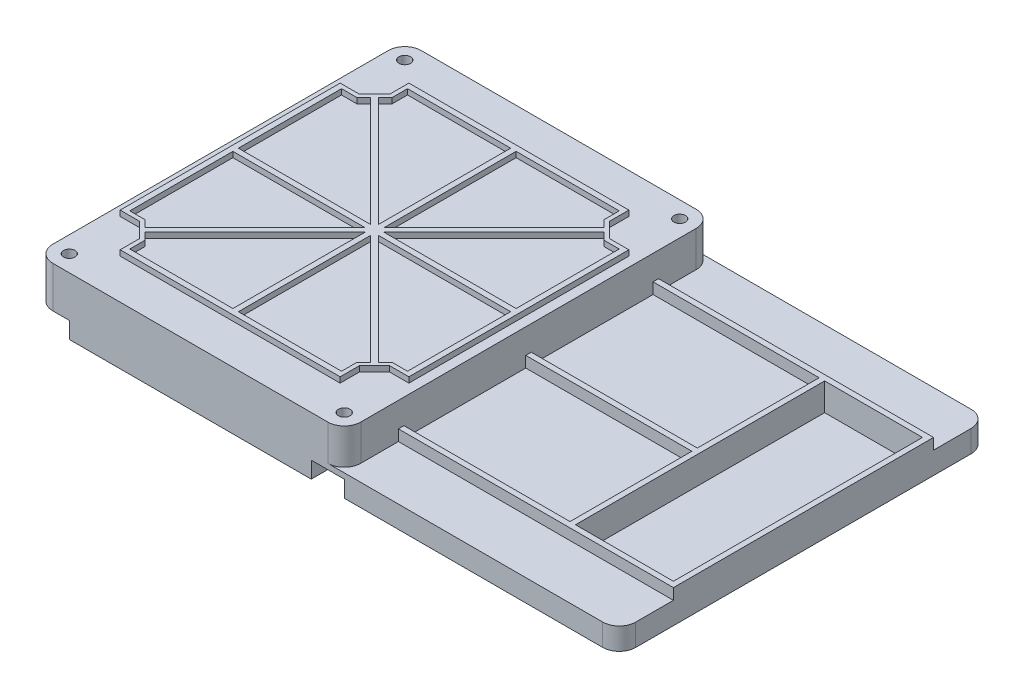
from build123d import *

# Parameters (mm, degrees)
SKETCH_1_R          = 2.1
EXTRUDE_1_DEPTH     = 2
SKETCH_2_W          = 100
SKETCH_2_H          = 134
EXTRUDE_2_DEPTH     = 2
EXTRUDE_3_DEPTH     = 6
FILLET_1_R          = 6
EXTRUDE_START       = 13
SKETCH_5_R          = 2.1
EXTRUDE_4_DEPTH     = 13
CUT_EXTRUDE_1_DEPTH = 6
SKETCH_7_W          = 39.6
SKETCH_7_H          = 94.6
SKETCH_7_W_2        = 35.6
SKETCH_7_H_2        = 90.6
EXTRUDE_5_DEPTH     = 4
SHELL_START         = -6
SHELL_1_DEPTH       = 19
SHELL_1_2_DEPTH     = 6
SHELL_START_2       = 2
SHELL_1_3_DEPTH     = 11
EXTRUDE_6_REACH     = 289.853
EXTRUDE_7_DEPTH     = 2
EXTRUDE_8_REACH     = 290.145
SKETCH_10_W         = 2
SKETCH_10_H         = 17.7
EXTRUDE_9_REACH     = 290.145
SKETCH_12_W         = 60.4
SKETCH_12_H         = 2
EXTRUDE_10_DEPTH    = 4


# Read off the part's stored shape, not the designer's step: 抽壳1
with BuildPart() as part:
    # 草图1 → 凸台-拉伸1 (new body)
    with BuildSketch(Plane(origin=(0, 0, 0), x_dir=(1, 0, 0), z_dir=(0, 1, 0))):
        Polygon((45.622350896, -7), (157.622350896, -7), (157.622350896, 127), (101.622350896, 127), (45.622350896, 127), align=None)
        with Locations(Location((151.622350896, -1, 0), (0, 0, 270))):
            Circle(SKETCH_1_R, mode=Mode.SUBTRACT)
        with Locations(Location((51.622350896, -1, 0), (0, 0, 270))):
            Circle(SKETCH_1_R, mode=Mode.SUBTRACT)
        with Locations(Location((151.622350896, 121, 0), (0, 0, 270))):
            Circle(SKETCH_1_R, mode=Mode.SUBTRACT)
        with Locations(Location((51.622350896, 121, 0), (0, 0, 270))):
            Circle(SKETCH_1_R, mode=Mode.SUBTRACT)
    extrude(amount=EXTRUDE_1_DEPTH)

    # 草图2 → 凸台-拉伸2 (add)
    with BuildSketch(Plane(origin=(0, 2, 0), x_dir=(1, 0, 0), z_dir=(0, 1, 0))):
        with Locations((207.622350896, 60)):
            Rectangle(SKETCH_2_W, SKETCH_2_H)
    extrude(amount=-EXTRUDE_2_DEPTH)

    # 草图3 → 凸台-拉伸3 (add)
    with BuildSketch(Plane.XZ):
        with BuildLine():
            Line((57.622350896, 1), (57.622350896, 7))
            Line((57.622350896, 7), (145.622350896, 7))
            Line((145.622350896, 7), (145.622350896, 1))
            ThreePointArc((145.622350896, 1), (151.622350896, -5), (157.622350896, 1))
            Line((157.622350896, 1), (157.622350896, 7))
            Line((157.622350896, 7), (257.622350896, 7))
            Line((257.622350896, 7), (257.622350896, -127))
            Line((257.622350896, -127), (157.622350896, -127))
            Line((157.622350896, -127), (157.622350896, -121))
            ThreePointArc((157.622350896, -121), (151.622350896, -115), (145.622350896, -121))
            Line((145.622350896, -121), (145.622350896, -127))
            Line((145.622350896, -127), (57.622350896, -127))
            Line((57.622350896, -127), (57.622350896, -121))
            ThreePointArc((57.622350896, -121), (55.864991583, -116.757359313), (51.622350896, -115))
            Line((51.622350896, -115), (45.622350896, -115))
            Line((45.622350896, -115), (45.622350896, -5))
            Line((45.622350896, -5), (51.622350896, -5))
            ThreePointArc((51.622350896, -5), (55.864991583, -3.242640687), (57.622350896, 1))
        make_face()
    extrude(amount=EXTRUDE_3_DEPTH)

    # 圆角1
    fillet_1_edges = [part.edges().sort_by_distance(p)[0] for p in [
        (257.622350896, -2, -127),
        (257.622350896, -2, 7),
        (45.622350896, 1, 7),
        (45.622350896, 1, -127),
    ]]
    fillet(fillet_1_edges, radius=FILLET_1_R)

    # 草图5 → 凸台-拉伸4 (add)
    with BuildSketch(Plane(origin=(0, 2, 0), x_dir=(1, 0, 0), z_dir=(0, 1, 0)).offset(EXTRUDE_START)):
        with BuildLine():
            Line((157.622350896, 60), (157.622350896, 121))
            ThreePointArc((157.622350896, 121), (155.864991583, 125.242640687), (151.622350896, 127))
            Line((151.622350896, 127), (51.622350896, 127))
            ThreePointArc((51.622350896, 127), (47.379710209, 125.242640687), (45.622350896, 121))
            Line((45.622350896, 121), (45.622350896, -1))
            ThreePointArc((45.622350896, -1), (47.379710209, -5.242640687), (51.622350896, -7))
            Line((51.622350896, -7), (151.622350896, -7))
            ThreePointArc((151.622350896, -7), (155.864991583, -5.242640687), (157.622350896, -1))
            Line((157.622350896, -1), (157.622350896, 60))
        make_face()
        with Locations(Location((151.622350896, -1, 0), (0, 0, 270))):
            Circle(SKETCH_5_R, mode=Mode.SUBTRACT)
        with Locations(Location((51.622350896, -1, 0), (0, 0, 270))):
            Circle(SKETCH_5_R, mode=Mode.SUBTRACT)
        with Locations(Location((51.622350896, 121, 0), (0, 0, 270))):
            Circle(SKETCH_5_R, mode=Mode.SUBTRACT)
        with Locations(Location((151.622350896, 121, 0), (0, 0, 270))):
            Circle(SKETCH_5_R, mode=Mode.SUBTRACT)
    extrude(amount=-EXTRUDE_4_DEPTH)

    # 草图6 → 切除-拉伸1 (cut)
    with BuildSketch(Plane(origin=(0, 2, 0), x_dir=(1, 0, 0), z_dir=(0, 1, 0))):
        Polygon((255.622350896, 60), (255.622350896, 105.3), (220.022350896, 105.3), (220.022350896, 14.7), (255.622350896, 14.7), align=None)
    extrude(amount=-CUT_EXTRUDE_1_DEPTH, mode=Mode.SUBTRACT)

    # 草图7 → 凸台-拉伸5 (add)
    with BuildSketch(Plane(origin=(0, 2, 0), x_dir=(1, 0, 0), z_dir=(0, 1, 0))):
        with Locations((237.822350896, 60)):
            Rectangle(SKETCH_7_W, SKETCH_7_H)
        with Locations((237.822350896, 60)):
            Rectangle(SKETCH_7_W_2, SKETCH_7_H_2, mode=Mode.SUBTRACT)
    extrude(amount=EXTRUDE_5_DEPTH)

    # 抽壳1 outline → 抽壳1 (cut)
    with BuildSketch(Plane(origin=(0, 0, 0), x_dir=(1, 0, 0), z_dir=(0, 1, 0)).offset(SHELL_START)):
        with BuildLine():
            Line((155.622350896, 5.92820323), (155.622350896, 114.07179677))
            ThreePointArc((155.622350896, 114.07179677), (147.622350896, 114.07179677), (143.622350896, 121))
            Line((143.622350896, 121), (143.622350896, 125))
            Line((143.622350896, 125), (59.622350896, 125))
            Line((59.622350896, 125), (59.622350896, 121))
            ThreePointArc((59.622350896, 121), (57.279205146, 115.34314575), (51.622350896, 113))
            Line((51.622350896, 113), (47.622350896, 113))
            Line((47.622350896, 113), (47.622350896, 7))
            Line((47.622350896, 7), (51.622350896, 7))
            ThreePointArc((51.622350896, 7), (57.279205146, 4.65685425), (59.622350896, -1))
            Line((59.622350896, -1), (59.622350896, -5))
            Line((59.622350896, -5), (143.622350896, -5))
            Line((143.622350896, -5), (143.622350896, -1))
            ThreePointArc((143.622350896, -1), (147.622350896, 5.92820323), (155.622350896, 5.92820323))
        make_face()
    extrude(amount=SHELL_1_DEPTH, mode=Mode.SUBTRACT)

    # Shell 1 2 outline → Shell 1 2 (cut)
    with BuildSketch(Plane(origin=(0, 0, 0), x_dir=(1, 0, 0), z_dir=(0, 1, 0)).offset(SHELL_START)):
        with BuildLine():
            Line((218.022350896, 107.3), (255.622350896, 107.3))
            Line((255.622350896, 107.3), (255.622350896, 121))
            ThreePointArc((255.622350896, 121), (254.450778021, 123.828427125), (251.622350896, 125))
            Line((251.622350896, 125), (159.622350896, 125))
            Line((159.622350896, 125), (159.622350896, 121))
            ThreePointArc((159.622350896, 121), (158.550554126, 117), (155.622350896, 114.07179677))
            Line((155.622350896, 114.07179677), (155.622350896, 5.92820323))
            ThreePointArc((155.622350896, 5.92820323), (158.550554126, 3), (159.622350896, -1))
            Line((159.622350896, -1), (159.622350896, -5))
            Line((159.622350896, -5), (251.622350896, -5))
            ThreePointArc((251.622350896, -5), (254.450778021, -3.828427125), (255.622350896, -1))
            Line((255.622350896, -1), (255.622350896, 12.7))
            Line((255.622350896, 12.7), (218.022350896, 12.7))
            Line((218.022350896, 12.7), (218.022350896, 107.3))
        make_face()
    extrude(amount=SHELL_1_2_DEPTH, mode=Mode.SUBTRACT)

    # Shell 1 3 outline → Shell 1 3 (cut)
    with BuildSketch(Plane(origin=(0, 0, 0), x_dir=(1, 0, 0), z_dir=(0, 1, 0)).offset(SHELL_START_2)):
        with BuildLine():
            ThreePointArc((143.622350896, 121), (147.622350896, 114.07179677), (155.622350896, 114.07179677))
            Line((155.622350896, 114.07179677), (155.622350896, 120.1))
            ThreePointArc((155.622350896, 120.1), (148.723213093, 118.100862197), (150.722350896, 125))
            Line((150.722350896, 125), (143.622350896, 125))
            Line((143.622350896, 125), (143.622350896, 121))
        make_face()
        with BuildLine():
            Line((155.622350896, -0.1), (155.622350896, 5.92820323))
            ThreePointArc((155.622350896, 5.92820323), (147.622350896, 5.92820323), (143.622350896, -1))
            Line((143.622350896, -1), (143.622350896, -5))
            Line((143.622350896, -5), (150.722350896, -5))
            ThreePointArc((150.722350896, -5), (148.723213093, 1.899137803), (155.622350896, -0.1))
        make_face()
        with BuildLine():
            Line((59.622350896, 121), (59.622350896, 125))
            Line((59.622350896, 125), (52.522350896, 125))
            ThreePointArc((52.522350896, 125), (54.521488699, 118.100862197), (47.622350896, 120.1))
            Line((47.622350896, 120.1), (47.622350896, 113))
            Line((47.622350896, 113), (51.622350896, 113))
            ThreePointArc((51.622350896, 113), (57.279205146, 115.34314575), (59.622350896, 121))
        make_face()
        with BuildLine():
            Line((52.522350896, -5), (59.622350896, -5))
            Line((59.622350896, -5), (59.622350896, -1))
            ThreePointArc((59.622350896, -1), (57.279205146, 4.65685425), (51.622350896, 7))
            Line((51.622350896, 7), (47.622350896, 7))
            Line((47.622350896, 7), (47.622350896, -0.1))
            ThreePointArc((47.622350896, -0.1), (54.521488699, 1.899137803), (52.522350896, -5))
        make_face()
    extrude(amount=SHELL_1_3_DEPTH, mode=Mode.SUBTRACT)

    # 草图8 → 凸台-拉伸6 (add, up to next)
    with BuildSketch(Plane.XZ.offset(-13), mode=Mode.PRIVATE) as extrude_6_sk1:
        with BuildLine():
            Line((59.622350896, 5), (59.622350896, 1))
            ThreePointArc((59.622350896, 1), (57.279205146, -4.656854249), (51.622350896, -7))
            Line((51.622350896, -7), (47.622350896, -7))
            Line((47.622350896, -7), (47.622350896, 0.1))
            ThreePointArc((47.622350896, 0.1), (54.521488699, -1.899137803), (52.522350896, 5))
            Line((52.522350896, 5), (59.622350896, 5))
        make_face()
    extrude_6_tool1 = extrude(extrude_6_sk1.sketch, amount=EXTRUDE_6_REACH, mode=Mode.PRIVATE) - part.part
    # 草图8 → 凸台-拉伸6 (add, up to next)
    with BuildSketch(Plane.XZ.offset(-13), mode=Mode.PRIVATE) as extrude_6_sk2:
        with BuildLine():
            Line((155.622350896, -120.1), (155.622350896, -114.07179677))
            ThreePointArc((155.622350896, -114.07179677), (147.622350896, -114.07179677), (143.622350896, -121))
            Line((143.622350896, -121), (143.622350896, -125))
            Line((143.622350896, -125), (150.722350896, -125))
            ThreePointArc((150.722350896, -125), (148.723213093, -118.100862197), (155.622350896, -120.1))
        make_face()
    extrude_6_tool2 = extrude(extrude_6_sk2.sketch, amount=EXTRUDE_6_REACH, mode=Mode.PRIVATE) - part.part
    # 草图8 → 凸台-拉伸6 (add, up to next)
    with BuildSketch(Plane.XZ.offset(-13), mode=Mode.PRIVATE) as extrude_6_sk3:
        with BuildLine():
            Line((150.722350896, 5), (143.622350896, 5))
            Line((143.622350896, 5), (143.622350896, 1))
            ThreePointArc((143.622350896, 1), (147.622350896, -5.92820323), (155.622350896, -5.92820323))
            Line((155.622350896, -5.92820323), (155.622350896, 0.1))
            ThreePointArc((155.622350896, 0.1), (148.723213093, -1.899137803), (150.722350896, 5))
        make_face()
    extrude_6_tool3 = extrude(extrude_6_sk3.sketch, amount=EXTRUDE_6_REACH, mode=Mode.PRIVATE) - part.part
    # 草图8 → 凸台-拉伸6 (add, up to next)
    with BuildSketch(Plane.XZ.offset(-13), mode=Mode.PRIVATE) as extrude_6_sk4:
        with BuildLine():
            Line((52.522350896, -125), (59.622350896, -125))
            Line((59.622350896, -125), (59.622350896, -121))
            ThreePointArc((59.622350896, -121), (57.279205146, -115.343145751), (51.622350896, -113))
            Line((51.622350896, -113), (47.622350896, -113))
            Line((47.622350896, -113), (47.622350896, -120.1))
            ThreePointArc((47.622350896, -120.1), (54.521488699, -118.100862197), (52.522350896, -125))
        make_face()
    extrude_6_tool4 = extrude(extrude_6_sk4.sketch, amount=EXTRUDE_6_REACH, mode=Mode.PRIVATE) - part.part
    add(extrude_6_tool1.solids().sort_by_distance((56.072351, 13, 4.830294))[0])
    add(extrude_6_tool2.solids().sort_by_distance((155.452645, 13, -117.085898))[0])
    add(extrude_6_tool3.solids().sort_by_distance((155.452645, 13, -2.914102))[0])
    add(extrude_6_tool4.solids().sort_by_distance((56.072351, 13, -124.830294))[0])

    # 草图9 → 凸台-拉伸7 (add)
    with BuildSketch(Plane(origin=(0, 15, 0), x_dir=(1, 0, 0), z_dir=(0, 1, 0))):
        Polygon((61.622350895, 105.500000001), (61.622350895, 112.500000001), (63.122350895, 112.500000001), (140.122350895, 112.500000001), (141.622350895, 112.500000001), (141.622350895, 105.500000001), (147.122350895, 100.000000001), (154.122350895, 100.000000001), (154.122350895, 98.500000001), (154.122350895, 21.500000001), (154.122350895, 20.000000001), (147.122350899, 20.000000001), (141.622350895, 14.499999997), (141.622350895, 7.500000001), (140.122350895, 7.500000001), (63.122350895, 7.500000001), (61.622350895, 7.500000001), (61.622350895, 14.500000001), (56.122350895, 20.000000001), (49.122350895, 20.000000001), (49.122350895, 21.500000001), (49.122350895, 98.500000001), (49.122350895, 100.000000001), (56.122350895, 100.000000001), align=None)
        Polygon((140.122350895, 110.500000001), (140.122350895, 104.878679658), (142.604583942, 102.396446611), (102.622350895, 62.414213563), (102.622350895, 110.500000001), align=None, mode=Mode.SUBTRACT)
        Polygon((152.122350895, 98.500000001), (146.501030552, 98.500000001), (144.018797505, 100.982233048), (104.036564457, 61.000000001), (152.122350895, 61.000000001), align=None, mode=Mode.SUBTRACT)
        Polygon((51.122350895, 21.500000001), (54.743671239, 21.500000001), (56.743671239, 21.500000001), (59.225904286, 19.017766954), (99.208137333, 59.000000001), (51.122350895, 59.000000001), align=None, mode=Mode.SUBTRACT)
        Polygon((51.122350895, 98.500000001), (54.743671239, 98.500000001), (56.743671239, 98.500000001), (59.225904286, 100.982233048), (99.208137333, 61.000000001), (51.122350895, 61.000000001), align=None, mode=Mode.SUBTRACT)
        Polygon((152.122350895, 21.500000001), (146.501030555, 21.500000001), (144.018797506, 19.017766952), (104.036564457, 59.000000001), (152.122350895, 59.000000001), align=None, mode=Mode.SUBTRACT)
        Polygon((140.122350895, 9.500000001), (140.122350895, 15.121320341), (142.604583944, 17.60355339), (102.622350895, 57.585786439), (102.622350895, 9.500000001), align=None, mode=Mode.SUBTRACT)
        Polygon((63.122350895, 15.121320345), (63.122350895, 9.500000001), (100.622350895, 9.500000001), (100.622350895, 57.585786439), (60.640117848, 17.603553392), align=None, mode=Mode.SUBTRACT)
        Polygon((63.122350895, 110.500000001), (63.122350895, 104.878679657), (60.640117848, 102.39644661), (100.622350895, 62.414213563), (100.622350895, 110.500000001), align=None, mode=Mode.SUBTRACT)
    extrude(amount=EXTRUDE_7_DEPTH)

    # 草图10 → 凸台-拉伸8 (add, up to next)
    with BuildSketch(Plane.XZ.offset(6), mode=Mode.PRIVATE) as extrude_8_sk1:
        with Locations((219.022350896, -3.85)):
            Rectangle(SKETCH_10_W, SKETCH_10_H)
    extrude_8_tool1 = extrude(extrude_8_sk1.sketch, amount=-EXTRUDE_8_REACH, mode=Mode.PRIVATE) - part.part
    # 草图10 → 凸台-拉伸8 (add, up to next)
    with BuildSketch(Plane.XZ.offset(6), mode=Mode.PRIVATE) as extrude_8_sk2:
        with Locations((219.022350896, -116.15)):
            Rectangle(SKETCH_10_W, SKETCH_10_H)
    extrude_8_tool2 = extrude(extrude_8_sk2.sketch, amount=-EXTRUDE_8_REACH, mode=Mode.PRIVATE) - part.part
    # 草图10 → 凸台-拉伸8 (add, up to next)
    with BuildSketch(Plane.XZ.offset(6), mode=Mode.PRIVATE) as extrude_8_sk3:
        with BuildLine():
            Line((99.509673582, -61), (55.880605944, -114.227462518))
            ThreePointArc((55.880605944, -114.227462518), (56.693774535, -114.81286316), (57.427390154, -115.495318428))
            Line((57.427390154, -115.495318428), (100.622350896, -62.797466323))
            Line((100.622350896, -62.797466323), (100.622350896, -125))
            Line((100.622350896, -125), (102.622350896, -125))
            Line((102.622350896, -125), (102.622350896, -62.797466323))
            Line((102.622350896, -62.797466323), (145.817311638, -115.495318428))
            ThreePointArc((145.817311638, -115.495318428), (146.550927257, -114.81286316), (147.364095848, -114.227462518))
            Line((147.364095848, -114.227462518), (103.73502821, -61))
            Line((103.73502821, -61), (155.622350896, -61))
            Line((155.622350896, -61), (155.622350896, -114.07179677))
            ThreePointArc((155.622350896, -114.07179677), (156.688878032, -114.80885287), (157.622350896, -115.708497378))
            Line((157.622350896, -115.708497378), (157.622350896, -61))
            Line((157.622350896, -61), (218.022350896, -61))
            Line((218.022350896, -61), (218.022350896, -59))
            Line((218.022350896, -59), (157.622350896, -59))
            Line((157.622350896, -59), (157.622350896, -4.291502622))
            ThreePointArc((157.622350896, -4.291502622), (156.688878032, -5.19114713), (155.622350896, -5.92820323))
            Line((155.622350896, -5.92820323), (155.622350896, -59))
            Line((155.622350896, -59), (103.73502821, -59))
            Line((103.73502821, -59), (147.364095848, -5.772537482))
            ThreePointArc((147.364095848, -5.772537482), (146.550927257, -5.18713684), (145.817311638, -4.504681572))
            Line((145.817311638, -4.504681572), (102.622350896, -57.202533677))
            Line((102.622350896, -57.202533677), (102.622350896, 5))
            Line((102.622350896, 5), (100.622350896, 5))
            Line((100.622350896, 5), (100.622350896, -57.202533677))
            Line((100.622350896, -57.202533677), (57.427390154, -4.504681572))
            ThreePointArc((57.427390154, -4.504681572), (56.693774535, -5.18713684), (55.880605944, -5.772537482))
            Line((55.880605944, -5.772537482), (99.509673582, -59))
            Line((99.509673582, -59), (47.622350896, -59))
            Line((47.622350896, -59), (47.622350896, -61))
            Line((47.622350896, -61), (99.509673582, -61))
        make_face()
    extrude_8_tool3 = extrude(extrude_8_sk3.sketch, amount=-EXTRUDE_8_REACH, mode=Mode.PRIVATE) - part.part
    add(extrude_8_tool1.solids().sort_by_distance((219.022351, -6, -3.85))[0])
    add(extrude_8_tool2.solids().sort_by_distance((219.022351, -6, -116.15))[0])
    add(extrude_8_tool3.solids().sort_by_distance((118.10182, -6, -60))[0])

    # 草图11 → 凸台-拉伸9 (add, up to next)
    with BuildSketch(Plane.XZ.offset(6), mode=Mode.PRIVATE) as extrude_9_sk1:
        Polygon((47.622350896, -59), (48.920731047, -59), (74.34495788, -28.299046843), (73.053238159, -26.723148784), (47.622350896, -57.432144724), align=None)
    extrude_9_tool1 = extrude(extrude_9_sk1.sketch, amount=-EXTRUDE_9_REACH, mode=Mode.PRIVATE) - part.part
    # 草图11 → 凸台-拉伸9 (add, up to next)
    with BuildSketch(Plane.XZ.offset(6), mode=Mode.PRIVATE) as extrude_9_sk2:
        Polygon((74.352876199, -25.153774547), (75.64459592, -26.729672606), (100.622350896, 3.432144724), (100.622350896, 5), (99.323970745, 5), align=None)
    extrude_9_tool2 = extrude(extrude_9_sk2.sketch, amount=-EXTRUDE_9_REACH, mode=Mode.PRIVATE) - part.part
    # 草图11 → 凸台-拉伸9 (add, up to next)
    with BuildSketch(Plane.XZ.offset(6), mode=Mode.PRIVATE) as extrude_9_sk3:
        Polygon((102.622350896, 5), (102.622350896, 3.432144724), (127.600105872, -26.729672606), (128.891825593, -25.153774547), (103.920731047, 5), align=None)
    extrude_9_tool3 = extrude(extrude_9_sk3.sketch, amount=-EXTRUDE_9_REACH, mode=Mode.PRIVATE) - part.part
    # 草图11 → 凸台-拉伸9 (add, up to next)
    with BuildSketch(Plane.XZ.offset(6), mode=Mode.PRIVATE) as extrude_9_sk4:
        Polygon((130.191463633, -26.723148784), (128.899743912, -28.299046843), (154.323970745, -59), (155.622350896, -59), (155.622350896, -57.432144724), align=None)
    extrude_9_tool4 = extrude(extrude_9_sk4.sketch, amount=-EXTRUDE_9_REACH, mode=Mode.PRIVATE) - part.part
    # 草图11 → 凸台-拉伸9 (add, up to next)
    with BuildSketch(Plane.XZ.offset(6), mode=Mode.PRIVATE) as extrude_9_sk5:
        Polygon((100.622350896, -125), (100.622350896, -123.432144724), (75.64459592, -93.270327394), (74.352876199, -94.846225453), (99.323970745, -125), align=None)
    extrude_9_tool5 = extrude(extrude_9_sk5.sketch, amount=-EXTRUDE_9_REACH, mode=Mode.PRIVATE) - part.part
    # 草图11 → 凸台-拉伸9 (add, up to next)
    with BuildSketch(Plane.XZ.offset(6), mode=Mode.PRIVATE) as extrude_9_sk6:
        Polygon((73.053238159, -93.276851216), (74.34495788, -91.700953157), (48.920731047, -61), (47.622350896, -61), (47.622350896, -62.567855276), align=None)
    extrude_9_tool6 = extrude(extrude_9_sk6.sketch, amount=-EXTRUDE_9_REACH, mode=Mode.PRIVATE) - part.part
    # 草图11 → 凸台-拉伸9 (add, up to next)
    with BuildSketch(Plane.XZ.offset(6), mode=Mode.PRIVATE) as extrude_9_sk7:
        Polygon((155.622350896, -61), (154.323970746, -61), (128.899743912, -91.700953157), (130.191463633, -93.276851216), (155.622350896, -62.567855276), align=None)
    extrude_9_tool7 = extrude(extrude_9_sk7.sketch, amount=-EXTRUDE_9_REACH, mode=Mode.PRIVATE) - part.part
    # 草图11 → 凸台-拉伸9 (add, up to next)
    with BuildSketch(Plane.XZ.offset(6), mode=Mode.PRIVATE) as extrude_9_sk8:
        Polygon((128.891825593, -94.846225453), (127.600105872, -93.270327394), (102.622350896, -123.432144724), (102.622350896, -125), (103.920731047, -125), align=None)
    extrude_9_tool8 = extrude(extrude_9_sk8.sketch, amount=-EXTRUDE_9_REACH, mode=Mode.PRIVATE) - part.part
    # 草图11 → 凸台-拉伸9 (add, up to next)
    with BuildSketch(Plane.XZ.offset(6), mode=Mode.PRIVATE) as extrude_9_sk9:
        Polygon((218.022350896, -125), (218.022350896, -123.543031307), (158.997365101, -61), (157.622350896, -61), (157.622350896, -62.456968693), (216.647336692, -125), align=None)
    extrude_9_tool9 = extrude(extrude_9_sk9.sketch, amount=-EXTRUDE_9_REACH, mode=Mode.PRIVATE) - part.part
    # 草图11 → 凸台-拉伸9 (add, up to next)
    with BuildSketch(Plane.XZ.offset(6), mode=Mode.PRIVATE) as extrude_9_sk10:
        Polygon((218.022350896, 5), (216.647336692, 5), (157.622350896, -57.543031307), (157.622350896, -59), (158.997365101, -59), (218.022350896, 3.543031307), align=None)
    extrude_9_tool10 = extrude(extrude_9_sk10.sketch, amount=-EXTRUDE_9_REACH, mode=Mode.PRIVATE) - part.part
    add(extrude_9_tool1.solids().sort_by_distance((60.822312, -6, -43.060357))[0])
    add(extrude_9_tool2.solids().sort_by_distance((87.648968, -6, -10.66604))[0])
    add(extrude_9_tool3.solids().sort_by_distance((115.595733, -6, -10.66604))[0])
    add(extrude_9_tool4.solids().sort_by_distance((142.42239, -6, -43.060357))[0])
    add(extrude_9_tool5.solids().sort_by_distance((87.648968, -6, -109.33396))[0])
    add(extrude_9_tool6.solids().sort_by_distance((60.822312, -6, -76.939643))[0])
    add(extrude_9_tool7.solids().sort_by_distance((142.42239, -6, -76.939643))[0])
    add(extrude_9_tool8.solids().sort_by_distance((115.595733, -6, -109.33396))[0])
    add(extrude_9_tool9.solids().sort_by_distance((187.822351, -6, -93))[0])
    add(extrude_9_tool10.solids().sort_by_distance((187.822351, -6, -27))[0])

    # 草图12 → 凸台-拉伸10 (add)
    with BuildSketch(Plane(origin=(0, 2, 0), x_dir=(1, 0, 0), z_dir=(0, 1, 0))):
        with Locations((187.822350896, 106.3)):
            Rectangle(SKETCH_12_W, SKETCH_12_H)
        with Locations((187.822350896, 60)):
            Rectangle(SKETCH_12_W, SKETCH_12_H)
        with Locations((187.822350896, 13.7)):
            Rectangle(SKETCH_12_W, SKETCH_12_H)
    extrude(amount=EXTRUDE_10_DEPTH)


solid = part.part
